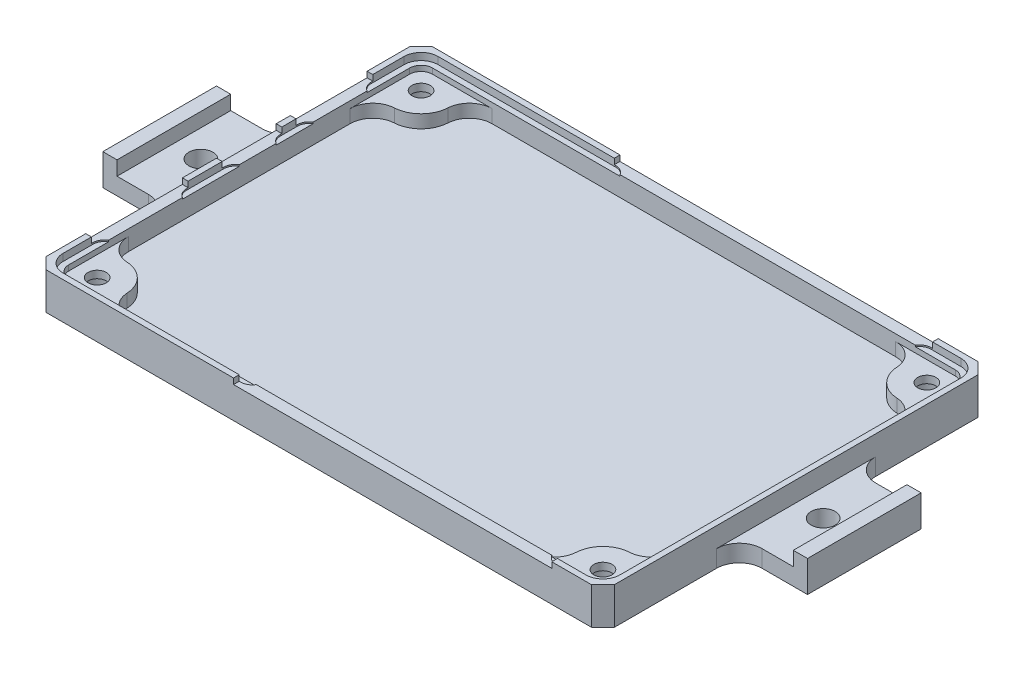
from build123d import *

# Parameters (mm, degrees)
BOSS_EXTRUDE1_DEPTH              = 5.5
PCB_BASIN_DEPTH                  = 3.5
PCB_START                        = 2.3
PCB_POSTS_DEPTH                  = 2.3
SKETCH4_R                        = 1.6
SCREW_HOLES_DEPTH                = 133.62691408
SKETCH6_R                        = 3
SCREW_CHAMFER_DEPTH              = 3
LIP_DEPTH                        = 1
BASIN_FILLET_R                   = 4
SKETCH12_W                       = 13.5
SKETCH12_H                       = 1.25
SKETCH12_W_2                     = 10.5
SKETCH12_W_3                     = 17
INTERFACE_CONNECTOR_CUTOUT_DEPTH = 10
SKETCH13_W                       = 56
SKETCH13_H                       = 1
POP_CONNECTOR_CUTOUT_DEPTH       = 126.563555911
CUT_EXTRUDE3_DEPTH               = 0.25
FILLET7_R                        = 2
SKETCH15_W                       = 12
SKETCH15_H                       = 20
MOUNTING_PEGS_DEPTH              = 3
MOUNTING_PEGS_FILLET_R           = 4
MOUNTING_PEG_LIPS_W              = 2.5
MOUNTING_PEG_LIPS_H              = 20
BOSS_EXTRUDE3_DEPTH              = 2.5
SKETCH17_R                       = 2.1
CUT_EXTRUDE4_DEPTH               = 3


with BuildPart() as part:
    # Sketch1 → Boss-Extrude1 (new body)
    with BuildSketch(Plane(origin=(0, 0, 0), x_dir=(1, 0, 0), z_dir=(0, 1, 0))):
        Polygon((-105.356331433, -14.372207668), (-103.356331433, -12.372207668), (-7.356331433, -12.372207668), (-5.356331433, -14.372207668), (-5.356331433, -78.372207668), (-7.356331433, -80.372207668), (-103.356331433, -80.372207668), (-105.356331433, -78.372207668), align=None)
    extrude(amount=BOSS_EXTRUDE1_DEPTH)

    # Sketch2 → pcb basin (cut)
    with BuildSketch(Plane(origin=(0, 5.5, 0), x_dir=(1, 0, 0), z_dir=(0, 1, 0))):
        with BuildLine():
            Line((-101.356331433, -14.372207668), (-9.356331433, -14.372207668))
            ThreePointArc((-9.356331433, -14.372207668), (-7.942117871, -14.957994106), (-7.356331433, -16.372207668))
            Line((-7.356331433, -16.372207668), (-7.356331433, -76.372207668))
            ThreePointArc((-7.356331433, -76.372207668), (-7.942117871, -77.78642123), (-9.356331433, -78.372207668))
            Line((-9.356331433, -78.372207668), (-101.356331433, -78.372207668))
            ThreePointArc((-101.356331433, -78.372207668), (-102.770544996, -77.78642123), (-103.356331433, -76.372207668))
            Line((-103.356331433, -76.372207668), (-103.356331433, -16.372207668))
            ThreePointArc((-103.356331433, -16.372207668), (-102.770544996, -14.957994106), (-101.356331433, -14.372207668))
        make_face()
    extrude(amount=-PCB_BASIN_DEPTH, mode=Mode.SUBTRACT)

    # Sketch3 → pcb posts (add)
    with BuildSketch(Plane(origin=(0, 2, 0), x_dir=(1, 0, 0), z_dir=(0, 1, 0)).offset(PCB_START)):
        with BuildLine():
            Line((-103.356331433, -69.872207668), (-99.856331433, -69.872207668))
            ThreePointArc((-99.856331433, -69.872207668), (-96.320797527, -71.336673762), (-94.856331433, -74.872207668))
            Line((-94.856331433, -74.872207668), (-94.856331433, -78.372207668))
            Line((-94.856331433, -78.372207668), (-101.356331433, -78.372207668))
            ThreePointArc((-101.356331433, -78.372207668), (-102.770544996, -77.78642123), (-103.356331433, -76.372207668))
            Line((-103.356331433, -76.372207668), (-103.356331433, -69.872207668))
        make_face()
        with BuildLine():
            Line((-7.356331433, -69.872207668), (-7.356331433, -76.372207668))
            ThreePointArc((-7.356331433, -76.372207668), (-7.942117871, -77.78642123), (-9.356331433, -78.372207668))
            Line((-9.356331433, -78.372207668), (-15.856331433, -78.372207668))
            Line((-15.856331433, -78.372207668), (-15.856331433, -74.872207668))
            ThreePointArc((-15.856331433, -74.872207668), (-14.391865339, -71.336673762), (-10.856331433, -69.872207668))
            Line((-10.856331433, -69.872207668), (-7.356331433, -69.872207668))
        make_face()
        with BuildLine():
            Line((-7.356331433, -22.872207668), (-10.856331433, -22.872207668))
            ThreePointArc((-10.856331433, -22.872207668), (-14.391865339, -21.407741574), (-15.856331433, -17.872207668))
            Line((-15.856331433, -17.872207668), (-15.856331433, -14.372207668))
            Line((-15.856331433, -14.372207668), (-9.356331433, -14.372207668))
            ThreePointArc((-9.356331433, -14.372207668), (-7.942117871, -14.957994106), (-7.356331433, -16.372207668))
            Line((-7.356331433, -16.372207668), (-7.356331433, -22.872207668))
        make_face()
        with BuildLine():
            Line((-103.356331433, -22.872207668), (-103.356331433, -16.372207668))
            ThreePointArc((-103.356331433, -16.372207668), (-102.770544996, -14.957994106), (-101.356331433, -14.372207668))
            Line((-101.356331433, -14.372207668), (-94.856331433, -14.372207668))
            Line((-94.856331433, -14.372207668), (-94.856331433, -17.872207668))
            ThreePointArc((-94.856331433, -17.872207668), (-96.320797527, -21.407741574), (-99.856331433, -22.872207668))
            Line((-99.856331433, -22.872207668), (-103.356331433, -22.872207668))
        make_face()
    extrude(amount=-PCB_POSTS_DEPTH)

    # Sketch4 → screw holes (cut, through all)
    with BuildSketch(Plane.XZ):
        with Locations(Location((-99.856331433, 17.872207668, 0), (0, 0, 270))):
            Circle(SKETCH4_R)
        with Locations(Location((-10.856331433, 17.872207668, 0), (0, 0, 270))):
            Circle(SKETCH4_R)
        with Locations(Location((-10.856331433, 74.872207668, 0), (0, 0, 270))):
            Circle(SKETCH4_R)
        with Locations(Location((-99.856331433, 74.872207668, 0), (0, 0, 270))):
            Circle(SKETCH4_R)
    extrude(amount=-SCREW_HOLES_DEPTH, mode=Mode.SUBTRACT)

    # Sketch6 → screw chamfer (cut)
    with BuildSketch(Plane.XZ):
        with Locations(Location((-99.856331433, 17.872207668, 0), (0, 0, 270))):
            Circle(SKETCH6_R)
        with Locations(Location((-10.856331433, 17.872207668, 0), (0, 0, 270))):
            Circle(SKETCH6_R)
        with Locations(Location((-10.856331433, 74.872207668, 0), (0, 0, 270))):
            Circle(SKETCH6_R)
        with Locations(Location((-99.856331433, 74.872207668, 0), (0, 0, 270))):
            Circle(SKETCH6_R)
    extrude(amount=-SCREW_CHAMFER_DEPTH, mode=Mode.SUBTRACT)

    # Sketch11 → lip (add)
    with BuildSketch(Plane(origin=(0, 5.5, 0), x_dir=(1, 0, 0), z_dir=(0, 1, 0))):
        Polygon((-7.356331433, -12.372207668), (-103.356331433, -12.372207668), (-105.356331433, -14.372207668), (-105.356331433, -78.372207668), (-103.356331433, -80.372207668), (-7.356331433, -80.372207668), (-5.356331433, -78.372207668), (-5.356331433, -14.372207668), align=None)
        with BuildLine():
            Line((-9.356331433, -13.372207668), (-101.356331433, -13.372207668))
            ThreePointArc((-101.356331433, -13.372207668), (-103.477651777, -14.250887324), (-104.356331433, -16.372207668))
            Line((-104.356331433, -16.372207668), (-104.356331433, -76.372207668))
            ThreePointArc((-104.356331433, -76.372207668), (-103.477651777, -78.493528012), (-101.356331433, -79.372207668))
            Line((-101.356331433, -79.372207668), (-9.356331433, -79.372207668))
            ThreePointArc((-9.356331433, -79.372207668), (-7.23501109, -78.493528012), (-6.356331433, -76.372207668))
            Line((-6.356331433, -76.372207668), (-6.356331433, -16.372207668))
            ThreePointArc((-6.356331433, -16.372207668), (-7.23501109, -14.250887324), (-9.356331433, -13.372207668))
        make_face(mode=Mode.SUBTRACT)
    extrude(amount=LIP_DEPTH)

    # basin fillet
    # the kernel refuses this fillet: 4 mm, written as the material it adds along each edge
    with BuildSketch(Plane(origin=(-94.856331433, 4.3, 78.372207668), x_dir=(1, 0, 0), z_dir=(0, -1, 0)), Plane(origin=(-7.356331433, 4.3, 69.872207668), x_dir=(0, 0, -1), z_dir=(0, -1, 0))) as basin_fillet_piece_1:
        with BuildLine():
            CenterArc((3.986100378, -4), BASIN_FILLET_R, 90, 86.815261463)
            Line((-0.007722012, -3.777777778), (-0.407104251, -3.755555556))
            ThreePointArc((-0.407104251, -3.755555556), (-0.4, -3.5), (-0.4, 0))
            Line((-0.4, 0), (0, 0.4))
            Line((0, 0.4), (3.986100378, 0.4))
            Line((3.986100378, 0.4), (3.986100378, 0))
        make_face()
    extrude(amount=2.3)
    with BuildSketch(Plane(origin=(-103.356331433, 4.3, 69.872207668), x_dir=(0.9999979109116379, 0, 0.0020440578171697465), z_dir=(0, -1, 0)), Plane(origin=(-15.856331433, 4.3, 78.372207668), x_dir=(0.002044057817168806, 0, -0.9999979109116378), z_dir=(0, -1, 0)), Plane(origin=(-7.356331433, 4.3, 22.872207668), x_dir=(-0.9999979109116378, 0, -0.0020440578171688124), z_dir=(0, -1, 0)), Plane(origin=(-94.856331433, 4.3, 14.372207668), x_dir=(-0.0020440578171697444, 0, 0.9999979109116378), z_dir=(0, -1, 0))) as basin_fillet_piece_2:
        with BuildLine():
            CenterArc((3.991843824, -3.994268282), BASIN_FILLET_R, 93.067622569, 86.815261463)
            Line((-0.00814782, -3.98609205), (-0.408146984, -3.985274427))
            Line((-0.408146984, -3.985274427), (-0.399999164, 0.000817623))
            Line((-0.399999164, 0.000817623), (0.000817623, 0.399999164))
            ThreePointArc((0.000817623, 0.399999164), (3.500810311, 0.392844962), (3.756379854, 0.399426828))
            Line((3.756379854, 0.399426828), (3.77778567, 0))
        make_face()
    extrude(amount=2.3)
    with BuildSketch(Plane(origin=(-15.856331433, 4.3, 14.372207668), x_dir=(0.002044057817168806, 0, 0.9999979109116378), z_dir=(0, -1, 0)), Plane(origin=(-103.356331433, 4.3, 22.872207668), x_dir=(0.9999979109116379, 0, -0.002044057817168806), z_dir=(0, -1, 0))) as basin_fillet_piece_3:
        with BuildLine():
            CenterArc((3.991843824, 3.994268282), BASIN_FILLET_R, 180.117115968, 86.815261463)
            Line((-0.00814782, 3.98609205), (-0.408146984, 3.985274427))
            Line((-0.408146984, 3.985274427), (-0.399999164, -0.000817623))
            Line((-0.399999164, -0.000817623), (0.000817623, -0.399999164))
            ThreePointArc((0.000817623, -0.399999164), (3.500810311, -0.392844962), (3.756379854, -0.399426828))
            Line((3.756379854, -0.399426828), (3.77778567, 0))
        make_face()
    extrude(amount=2.3)

    # Sketch12 → interface connector cutout (cut)
    with BuildSketch(Plane.ZY.offset(105.356331433)):
        with Locations((28.622207668, 6.125)):
            Rectangle(SKETCH12_W, SKETCH12_H)
        with Locations((43.122207668, 6.125)):
            Rectangle(SKETCH12_W_2, SKETCH12_H)
        with Locations((62.872207668, 6.125)):
            Rectangle(SKETCH12_W_3, SKETCH12_H)
    extrude(amount=-INTERFACE_CONNECTOR_CUTOUT_DEPTH, mode=Mode.SUBTRACT)

    # Sketch13 → pop connector cutout (cut, through all)
    with BuildSketch(Plane(origin=(0, 0, 12.372207668), x_dir=(-1, 0, 0), z_dir=(0, 0, -1))):
        with Locations((42.356331433, 6)):
            Rectangle(SKETCH13_W, SKETCH13_H)
    extrude(amount=-POP_CONNECTOR_CUTOUT_DEPTH, mode=Mode.SUBTRACT)

    # Sketch14 → Cut-Extrude3 (cut)
    with BuildSketch(Plane(origin=(0, 5.5, 0), x_dir=(1, 0, 0), z_dir=(0, 1, 0))):
        Polygon((-103.356331433, -37.872207668), (-103.356331433, -39.872207668), (-104.356331433, -39.872207668), (-104.356331433, -37.872207668), (-104.356331433, -35.372207668), (-104.356331433, -33.372207668), (-103.356331433, -33.372207668), (-103.356331433, -35.372207668), align=None)
        with BuildLine():
            Line((-9.356331433, -14.372207668), (-14.356331433, -14.372207668))
            Line((-14.356331433, -14.372207668), (-16.356331433, -14.372207668))
            Line((-16.356331433, -14.372207668), (-16.356331433, -13.372207668))
            Line((-16.356331433, -13.372207668), (-14.356331433, -13.372207668))
            Line((-14.356331433, -13.372207668), (-9.356331433, -13.372207668))
            ThreePointArc((-9.356331433, -13.372207668), (-7.23501109, -14.250887324), (-6.356331433, -16.372207668))
            Line((-6.356331433, -16.372207668), (-6.356331433, -76.372207668))
            ThreePointArc((-6.356331433, -76.372207668), (-7.23501109, -78.493528012), (-9.356331433, -79.372207668))
            Line((-9.356331433, -79.372207668), (-14.356331433, -79.372207668))
            Line((-14.356331433, -79.372207668), (-16.356331433, -79.372207668))
            Line((-16.356331433, -79.372207668), (-16.356331433, -78.372207668))
            Line((-16.356331433, -78.372207668), (-14.356331433, -78.372207668))
            Line((-14.356331433, -78.372207668), (-9.356331433, -78.372207668))
            ThreePointArc((-9.356331433, -78.372207668), (-7.942117871, -77.78642123), (-7.356331433, -76.372207668))
            Line((-7.356331433, -76.372207668), (-7.356331433, -16.372207668))
            ThreePointArc((-7.356331433, -16.372207668), (-7.942117871, -14.957994106), (-9.356331433, -14.372207668))
        make_face()
        with BuildLine():
            Line((-101.356331433, -78.372207668), (-70.356331433, -78.372207668))
            Line((-70.356331433, -78.372207668), (-68.356331433, -78.372207668))
            Line((-68.356331433, -78.372207668), (-68.356331433, -79.372207668))
            Line((-68.356331433, -79.372207668), (-70.356331433, -79.372207668))
            Line((-70.356331433, -79.372207668), (-101.356331433, -79.372207668))
            ThreePointArc((-101.356331433, -79.372207668), (-103.477651777, -78.493528012), (-104.356331433, -76.372207668))
            Line((-104.356331433, -76.372207668), (-104.356331433, -71.372207668))
            Line((-104.356331433, -71.372207668), (-104.356331433, -69.372207668))
            Line((-104.356331433, -69.372207668), (-103.356331433, -69.372207668))
            Line((-103.356331433, -69.372207668), (-103.356331433, -71.372207668))
            Line((-103.356331433, -71.372207668), (-103.356331433, -76.372207668))
            ThreePointArc((-103.356331433, -76.372207668), (-102.770544996, -77.78642123), (-101.356331433, -78.372207668))
        make_face()
        with BuildLine():
            Line((-103.356331433, -16.372207668), (-103.356331433, -21.872207668))
            Line((-103.356331433, -21.872207668), (-103.356331433, -23.872207668))
            Line((-103.356331433, -23.872207668), (-104.356331433, -23.872207668))
            Line((-104.356331433, -23.872207668), (-104.356331433, -21.872207668))
            Line((-104.356331433, -21.872207668), (-104.356331433, -16.372207668))
            ThreePointArc((-104.356331433, -16.372207668), (-103.477651777, -14.250887324), (-101.356331433, -13.372207668))
            Line((-101.356331433, -13.372207668), (-70.356331433, -13.372207668))
            Line((-70.356331433, -13.372207668), (-68.356331433, -13.372207668))
            Line((-68.356331433, -13.372207668), (-68.356331433, -14.372207668))
            Line((-68.356331433, -14.372207668), (-70.356331433, -14.372207668))
            Line((-70.356331433, -14.372207668), (-101.356331433, -14.372207668))
            ThreePointArc((-101.356331433, -14.372207668), (-102.770544996, -14.957994106), (-103.356331433, -16.372207668))
        make_face()
        Polygon((-103.356331433, -48.372207668), (-103.356331433, -54.372207668), (-103.356331433, -56.372207668), (-104.356331433, -56.372207668), (-104.356331433, -54.372207668), (-104.356331433, -48.372207668), (-104.356331433, -46.372207668), (-103.356331433, -46.372207668), align=None)
    extrude(amount=-CUT_EXTRUDE3_DEPTH, mode=Mode.SUBTRACT)

    # Fillet7
    # the kernel refuses this fillet: 2 mm, written as the material it adds along each edge
    with BuildSketch(Plane(origin=(-68.356331433, 5.5, 79.372207668), x_dir=(-1, 0, 0), z_dir=(0, -1, 0)), Plane(origin=(-16.356331433, 5.5, 13.372207668), x_dir=(1, 0, 0), z_dir=(0, -1, 0))) as fillet7_piece_1:
        with BuildLine():
            CenterArc((1.732050808, 2), FILLET7_R, 210, 60)
            Line((0, 1), (-0.034641016, 0.98))
            ThreePointArc((-0.034641016, 0.98), (-0.04, 0.5), (-0.04, 0))
            Line((-0.04, 0), (0, -0.04))
            Line((0, -0.04), (1.732050808, -0.04))
            Line((1.732050808, -0.04), (1.732050808, 0))
        make_face()
    extrude(amount=4.580127019)
    with BuildSketch(Plane(origin=(-16.356331433, 5.5, 79.372207668), x_dir=(0, 0, -1), z_dir=(0, -1, 0)), Plane(origin=(-68.356331433, 5.5, 13.372207668), x_dir=(0, 0, 1), z_dir=(0, -1, 0)), Plane(origin=(-104.356331433, 5.5, 69.372207668), x_dir=(1, 0, 0), z_dir=(0, -1, 0)), Plane(origin=(-104.356331433, 5.5, 46.372207668), x_dir=(1, 0, 0), z_dir=(0, -1, 0)), Plane(origin=(-104.356331433, 5.5, 33.372207668), x_dir=(1, 0, 0), z_dir=(0, -1, 0))) as fillet7_piece_2:
        with BuildLine():
            CenterArc((2, 1.732050808), FILLET7_R, 180, 60)
            Line((0, 1.732050808), (-0.04, 1.732050808))
            Line((-0.04, 1.732050808), (-0.04, 0))
            Line((-0.04, 0), (0, -0.04))
            ThreePointArc((0, -0.04), (0.5, -0.04), (0.98, -0.034641016))
            Line((0.98, -0.034641016), (1, 0))
        make_face()
    extrude(amount=4.580127019)
    with BuildSketch(Plane(origin=(-104.356331433, 5.5, 23.872207668), x_dir=(1, 0, 0), z_dir=(0, -1, 0)), Plane(origin=(-104.356331433, 5.5, 56.372207668), x_dir=(1, 0, 0), z_dir=(0, -1, 0)), Plane(origin=(-104.356331433, 5.5, 39.872207668), x_dir=(1, 0, 0), z_dir=(0, -1, 0))) as fillet7_piece_3:
        with BuildLine():
            CenterArc((2, -1.732050808), FILLET7_R, 120, 60)
            Line((0, -1.732050808), (-0.04, -1.732050808))
            Line((-0.04, -1.732050808), (-0.04, 0))
            Line((-0.04, 0), (0, 0.04))
            ThreePointArc((0, 0.04), (0.5, 0.04), (0.98, 0.034641016))
            Line((0.98, 0.034641016), (1, 0))
        make_face()
    extrude(amount=4.580127019)

    # Sketch15 → mounting pegs (add)
    with BuildSketch(Plane.XZ):
        with Locations((-111.356331433, 46.372207668)):
            Rectangle(SKETCH15_W, SKETCH15_H)
        with Locations((0.643668567, 46.372207668)):
            Rectangle(SKETCH15_W, SKETCH15_H)
    extrude(amount=-MOUNTING_PEGS_DEPTH)

    # mounting pegs fillet
    mounting_pegs_fillet_edges = [part.edges().sort_by_distance(p)[0] for p in [
        (-105.356331433, 1.5, 56.372207668),
        (-105.356331433, 1.5, 36.372207668),
        (-5.356331433, 1.5, 36.372207668),
        (-5.356331433, 1.5, 56.372207668),
    ]]
    fillet(mounting_pegs_fillet_edges, radius=MOUNTING_PEGS_FILLET_R)

    # mounting peg lips → Boss-Extrude3 (add)
    with BuildSketch(Plane(origin=(0, 3, 0), x_dir=(1, 0, 0), z_dir=(0, 1, 0))):
        with Locations((-116.106331433, -46.372207668)):
            Rectangle(MOUNTING_PEG_LIPS_W, MOUNTING_PEG_LIPS_H)
        with Locations((5.393668567, -46.372207668)):
            Rectangle(MOUNTING_PEG_LIPS_W, MOUNTING_PEG_LIPS_H)
    extrude(amount=BOSS_EXTRUDE3_DEPTH)

    # Sketch17 → Cut-Extrude4 (cut)
    with BuildSketch(Plane(origin=(0, 3, 0), x_dir=(1, 0, 0), z_dir=(0, 1, 0))):
        with Locations(Location((-110.106331433, -46.372207668, 0), (0, 0, 270))):
            Circle(SKETCH17_R)
        with Locations(Location((-0.606331433, -46.372207668, 0), (0, 0, 270))):
            Circle(SKETCH17_R)
    extrude(amount=-CUT_EXTRUDE4_DEPTH, mode=Mode.SUBTRACT)


solid = part.part
